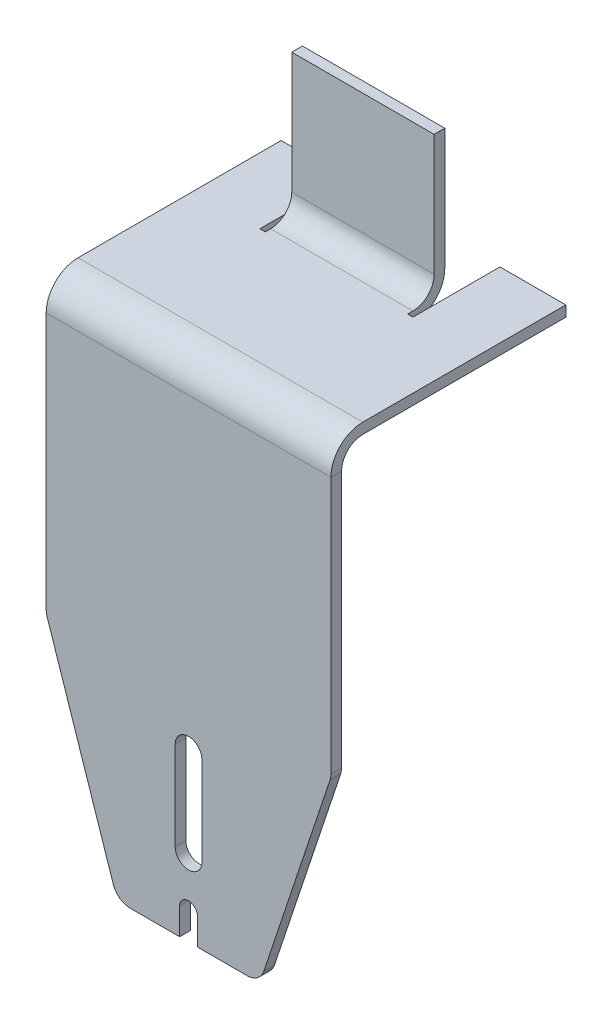
from build123d import *

# Parameters (mm, degrees)
BASE_FLANGE1_DEPTH  = 6
HEM2_DEPTH          = 160
SKETCH12_W          = 160
SKETCH12_H          = 6
BOSS_EXTRUDE2_DEPTH = 65.18
SKETCH13_W          = 37
SKETCH13_H          = 6
BOSS_EXTRUDE3_DEPTH = 48.91
SKETCH14_W          = 80
SKETCH14_H          = 6
BOSS_EXTRUDE4_DEPTH = 3
BOSS_EXTRUDE5_DEPTH = 80


# Read off the part's stored shape, not the designer's step: Hem2
# Sheet-metal steps are written as plain solids
with BuildPart() as part:
    # Sketch1 → Base-Flange1 (new body)
    with BuildSketch(Plane.XY):
        with BuildLine():
            Line((0, 0), (160, 0))
            Line((160, 0), (160, -144.47))
            ThreePointArc((160, -144.47), (159.87085305, -146.071955078), (159.486747986, -147.632532633))
            Line((159.486747986, -147.632532633), (122.276747986, -259.252532633))
            ThreePointArc((122.276747986, -259.252532633), (118.636993829, -264.202500426), (112.79, -266.09))
            Line((112.79, -266.09), (85, -266.09))
            Line((85, -266.09), (85, -251.09))
            ThreePointArc((85, -251.09), (80, -246.09), (75, -251.09))
            Line((75, -251.09), (75, -266.09))
            Line((75, -266.09), (47.21, -266.09))
            ThreePointArc((47.21, -266.09), (41.363006171, -264.202500426), (37.723252014, -259.252532633))
            Line((37.723252014, -259.252532633), (0.513252014, -147.632532633))
            ThreePointArc((0.513252014, -147.632532633), (0.12914695, -146.071955078), (0, -144.47))
            Line((0, -144.47), (0, 0))
        make_face()
        with BuildLine():
            Line((87.5, -173.59), (87.5, -223.59))
            ThreePointArc((87.5, -223.59), (80, -231.09), (72.5, -223.59))
            Line((72.5, -223.59), (72.5, -173.59))
            ThreePointArc((72.5, -173.59), (80, -166.09), (87.5, -173.59))
        make_face(mode=Mode.SUBTRACT)
    extrude(amount=-BASE_FLANGE1_DEPTH)

    # Hem2 outline → Hem2 (add)
    with BuildSketch(Plane.YZ):
        with BuildLine():
            Line((11.91, -17.91), (17.91, -17.91))
            ThreePointArc((17.91, -17.91), (12.664282451, -5.245717549), (0, 0))
            Line((0, 0), (0, -6))
            ThreePointArc((0, -6), (8.421641764, -9.488358236), (11.91, -17.91))
        make_face()
    extrude(amount=HEM2_DEPTH)

    # Sketch12 → Boss-Extrude2 (add)
    with BuildSketch(Plane(origin=(0, 0, -17.91), x_dir=(-1, 0, 0), z_dir=(0, 0, -1))):
        with Locations((-80, 14.91)):
            Rectangle(SKETCH12_W, SKETCH12_H)
    extrude(amount=BOSS_EXTRUDE2_DEPTH)

    # Sketch13 → Boss-Extrude3 (add)
    with BuildSketch(Plane(origin=(0, 0, -83.09), x_dir=(-1, 0, 0), z_dir=(0, 0, -1))):
        with Locations((-141.5, 14.91)):
            Rectangle(SKETCH13_W, SKETCH13_H)
        with Locations((-18.5, 14.91)):
            Rectangle(SKETCH13_W, SKETCH13_H)
    extrude(amount=BOSS_EXTRUDE3_DEPTH)

    # Sketch14 → Boss-Extrude4 (add)
    with BuildSketch(Plane(origin=(0, 0, -83.09), x_dir=(-1, 0, 0), z_dir=(0, 0, -1))):
        with Locations((-80, 14.91)):
            Rectangle(SKETCH14_W, SKETCH14_H)
    extrude(amount=BOSS_EXTRUDE4_DEPTH)

    # Sketch19 → Boss-Extrude5 (add)
    with BuildSketch(Plane(origin=(120, 0, 0), x_dir=(0, 0, -1), z_dir=(1, 0, 0))):
        with BuildLine():
            Line((98, 29.82), (98, 97.91))
            Line((98, 97.91), (104, 97.91))
            Line((104, 97.91), (104, 29.82))
            ThreePointArc((104, 29.82), (98.754282451, 17.155717549), (86.09, 11.91))
            Line((86.09, 11.91), (86.09, 17.91))
            ThreePointArc((86.09, 17.91), (94.511641764, 21.398358236), (98, 29.82))
        make_face()
    extrude(amount=-BOSS_EXTRUDE5_DEPTH)


solid = part.part
